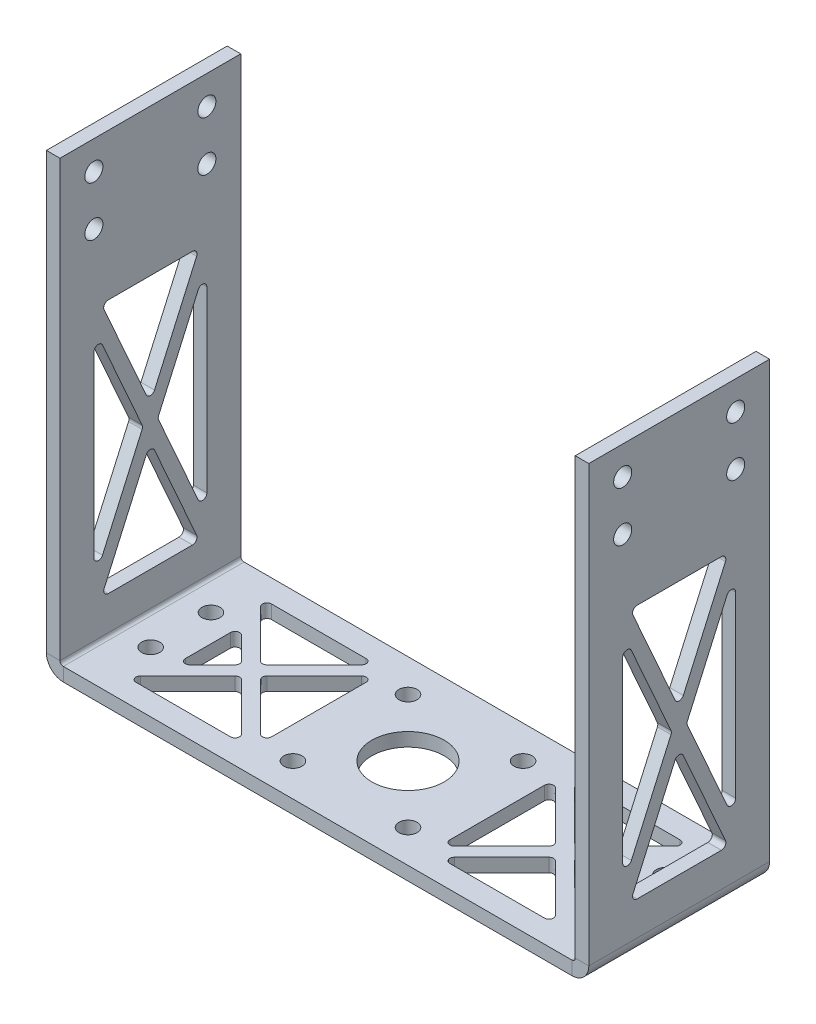
from build123d import *

# Parameters (mm, degrees)
SKETCH3_W                    = 114
SKETCH3_H                    = 40
BASE_FLANGE1_DEPTH           = 3
EDGE_FLANGE1_STRIP_W         = 13.4732
EDGE_FLANGE1_STRIP_H         = 3
EDGE_FLANGE1_STRIP_CUT_DEPTH = 40
EDGE_FLANGE1_DEPTH           = 40
EDGE_FLANGE2_STRIP_W         = 13.4732
EDGE_FLANGE2_STRIP_H         = 3
EDGE_FLANGE2_STRIP_CUT_DEPTH = 40
EDGE_FLANGE2_DEPTH           = 40
SKETCH11_R                   = 8
SKETCH11_R_2                 = 2
CUT_EXTRUDE1_DEPTH           = 10
CUT_EXTRUDE2_REACH           = 157.592
SKETCH12_R                   = 2
CUT_EXTRUDE3_DEPTH           = 156.592416268
CUT_EXTRUDE3_DEPTH_BACK      = 156.592416268
CUT_EXTRUDE4_DEPTH           = 10
FILLET1_R                    = 1


# Sheet-metal steps are written as plain solids
with BuildPart() as part:
    # Sketch3 → Base-Flange1 (new body)
    with BuildSketch(Plane(origin=(0, 0, 0), x_dir=(1, 0, 0), z_dir=(0, 1, 0))):
        Rectangle(SKETCH3_W, SKETCH3_H)
    extrude(amount=-BASE_FLANGE1_DEPTH)

    # Edge-Flange1 strip (across the edge) → Edge-Flange1 strip cut (cut)
    with BuildSketch(Plane(origin=(-57, 0, -20), x_dir=(1, 0, 0), z_dir=(0, 0, 1))):
        with Locations((-6, -1.5)):
            Rectangle(EDGE_FLANGE1_STRIP_W, EDGE_FLANGE1_STRIP_H)
    extrude(amount=EDGE_FLANGE1_STRIP_CUT_DEPTH, mode=Mode.SUBTRACT)

    # Edge-Flange1 section (across the edge) → Edge-Flange1 (add)
    with BuildSketch(Plane(origin=(-57, 0, -20), x_dir=(1, 0, 0), z_dir=(0, 0, 1))):
        with BuildLine():
            Line((-3, 0.7366), (-3, 97))
            Line((-3, 97), (0, 97))
            Line((0, 97), (0, 0.7366))
            ThreePointArc((0, 0.7366), (0.215745145, 0.215745145), (0.7366, 0))
            Line((0.7366, 0), (0.7366, -3))
            ThreePointArc((0.7366, -3), (-1.905575199, -1.905575199), (-3, 0.7366))
        make_face()
    extrude(amount=EDGE_FLANGE1_DEPTH)

    # Edge-Flange2 strip (across the edge) → Edge-Flange2 strip cut (cut)
    with BuildSketch(Plane(origin=(57, 0, 20), x_dir=(-1, 0, 0), z_dir=(0, 0, -1))):
        with Locations((-6, -1.5)):
            Rectangle(EDGE_FLANGE2_STRIP_W, EDGE_FLANGE2_STRIP_H)
    extrude(amount=EDGE_FLANGE2_STRIP_CUT_DEPTH, mode=Mode.SUBTRACT)

    # Edge-Flange2 section (across the edge) → Edge-Flange2 (add)
    with BuildSketch(Plane(origin=(57, 0, 20), x_dir=(-1, 0, 0), z_dir=(0, 0, -1))):
        with BuildLine():
            Line((-3, 0.7366), (-3, 97))
            Line((-3, 97), (0, 97))
            Line((0, 97), (0, 0.7366))
            ThreePointArc((0, 0.7366), (0.215745145, 0.215745145), (0.7366, 0))
            Line((0.7366, 0), (0.7366, -3))
            ThreePointArc((0.7366, -3), (-1.905575199, -1.905575199), (-3, 0.7366))
        make_face()
    extrude(amount=EDGE_FLANGE2_DEPTH)

    # Sketch11 → Cut-Extrude1 (cut)
    with BuildSketch(Plane(origin=(0, -3, 0), x_dir=(-1, 0, 0), z_dir=(0, -1, 0))):
        with Locations(Location((0, 0, 0), (0, 0, 90))):
            Circle(SKETCH11_R)
        with Locations(Location((12.727922061, 12.727922061, 0), (0, 0, 90))):
            Circle(SKETCH11_R_2)
        with Locations(Location((12.727922061, -12.727922061, 0), (0, 0, 90))):
            Circle(SKETCH11_R_2)
        with Locations(Location((-12.727922061, -12.727922061, 0), (0, 0, 90))):
            Circle(SKETCH11_R_2)
        with Locations(Location((-12.727922061, 12.727922061, 0), (0, 0, 90))):
            Circle(SKETCH11_R_2)
        with Locations(Location((50.2634, 6.666666667, 0), (0, 0, 90))):
            Circle(SKETCH11_R_2)
        with Locations(Location((-50.2634, 6.666666667, 0), (0, 0, 90))):
            Circle(SKETCH11_R_2)
        with Locations(Location((50.2634, -6.666666667, 0), (0, 0, 90))):
            Circle(SKETCH11_R_2)
        with Locations(Location((-50.2634, -6.666666667, 0), (0, 0, 90))):
            Circle(SKETCH11_R_2)
    extrude(amount=-CUT_EXTRUDE1_DEPTH, mode=Mode.SUBTRACT)

    # Cut-Extrude2: up to this face of the body (flat: up to its plane)
    cut_extrude2_end = Plane(part.part.faces().sort_by_distance((-60, 48.8683, 0))[0])
    # Sketch12 → Cut-Extrude2 (cut, up to the picked face)
    with BuildSketch(Plane(origin=(60, 0, 0), x_dir=(0, 0, -1), z_dir=(1, 0, 0)), mode=Mode.PRIVATE) as cut_extrude2_sk1:
        with Locations(Location((12.5, 79.674243403, 0), (0, 0, 90))):
            Circle(SKETCH12_R)
    cut_extrude2_tool1 = split(extrude(cut_extrude2_sk1.sketch, amount=-CUT_EXTRUDE2_REACH, mode=Mode.PRIVATE), bisect_by=cut_extrude2_end, keep=Keep.BOTH, mode=Mode.PRIVATE)
    # Sketch12 → Cut-Extrude2 (cut, up to the picked face)
    with BuildSketch(Plane(origin=(60, 0, 0), x_dir=(0, 0, -1), z_dir=(1, 0, 0)), mode=Mode.PRIVATE) as cut_extrude2_sk2:
        with Locations(Location((12.5, 90.674243403, 0), (0, 0, 90))):
            Circle(SKETCH12_R)
    cut_extrude2_tool2 = split(extrude(cut_extrude2_sk2.sketch, amount=-CUT_EXTRUDE2_REACH, mode=Mode.PRIVATE), bisect_by=cut_extrude2_end, keep=Keep.BOTH, mode=Mode.PRIVATE)
    # Sketch12 → Cut-Extrude2 (cut, up to the picked face)
    with BuildSketch(Plane(origin=(60, 0, 0), x_dir=(0, 0, -1), z_dir=(1, 0, 0)), mode=Mode.PRIVATE) as cut_extrude2_sk3:
        with Locations(Location((-12.5, 79.674243403, 0), (0, 0, 90))):
            Circle(SKETCH12_R)
    cut_extrude2_tool3 = split(extrude(cut_extrude2_sk3.sketch, amount=-CUT_EXTRUDE2_REACH, mode=Mode.PRIVATE), bisect_by=cut_extrude2_end, keep=Keep.BOTH, mode=Mode.PRIVATE)
    # Sketch12 → Cut-Extrude2 (cut, up to the picked face)
    with BuildSketch(Plane(origin=(60, 0, 0), x_dir=(0, 0, -1), z_dir=(1, 0, 0)), mode=Mode.PRIVATE) as cut_extrude2_sk4:
        with Locations(Location((-12.5, 90.674243403, 0), (0, 0, 90))):
            Circle(SKETCH12_R)
    cut_extrude2_tool4 = split(extrude(cut_extrude2_sk4.sketch, amount=-CUT_EXTRUDE2_REACH, mode=Mode.PRIVATE), bisect_by=cut_extrude2_end, keep=Keep.BOTH, mode=Mode.PRIVATE)
    add(cut_extrude2_tool1.solids().sort_by(Axis((60, 79.674243, -12.5), (-1, 0, 0)))[0], mode=Mode.SUBTRACT)
    add(cut_extrude2_tool2.solids().sort_by(Axis((60, 90.674243, -12.5), (-1, 0, 0)))[0], mode=Mode.SUBTRACT)
    add(cut_extrude2_tool3.solids().sort_by(Axis((60, 79.674243, 12.5), (-1, 0, 0)))[0], mode=Mode.SUBTRACT)
    add(cut_extrude2_tool4.solids().sort_by(Axis((60, 90.674243, 12.5), (-1, 0, 0)))[0], mode=Mode.SUBTRACT)

    # Sketch14 → Cut-Extrude3 (cut, two sides: drawn at the far end of the back side and taken through both)
    with BuildSketch(Plane(origin=(60, 0, 0), x_dir=(0, 0, -1), z_dir=(1, 0, 0)).offset(-CUT_EXTRUDE3_DEPTH_BACK)):
        Polygon((-12.5, 60.805943605), (-1.641411821, 36.3683), (-12.5, 11.930656395), align=None)
        Polygon((-10.858588179, 64.5), (0, 40.062356395), (10.858588179, 64.5), align=None)
        Polygon((12.5, 60.805943605), (1.641411821, 36.3683), (12.5, 11.930656395), align=None)
        Polygon((10.858588179, 8.2366), (0, 32.674243605), (-10.858588179, 8.2366), align=None)
    extrude(amount=CUT_EXTRUDE3_DEPTH + CUT_EXTRUDE3_DEPTH_BACK, mode=Mode.SUBTRACT)

    # Sketch15 → Cut-Extrude4 (cut)
    with BuildSketch(Plane.XZ.offset(3)):
        Polygon((19.727922061, 12.878679656), (32.606601718, 0), (19.727922061, -12.878679656), align=None)
        Polygon((21.849242405, 15), (34.727922061, 2.121320344), (47.606601718, 15), align=None)
        Polygon((44.2634, 7.414157595), (36.849242405, 0), (44.2634, -7.414157595), align=None)
        Polygon((47.606601718, -15), (34.727922061, -2.121320344), (21.849242405, -15), align=None)
        Polygon((-21.849242405, -15), (-47.606601718, -15), (-34.727922061, -2.121320344), align=None)
        Polygon((-44.2634, -7.414157595), (-44.2634, 7.414157595), (-36.849242405, 0), align=None)
        Polygon((-47.606601718, 15), (-21.849242405, 15), (-34.727922061, 2.121320344), align=None)
        Polygon((-19.727922061, -12.878679656), (-19.727922061, 12.878679656), (-32.606601718, 0), align=None)
    extrude(amount=-CUT_EXTRUDE4_DEPTH, mode=Mode.SUBTRACT)

    # Fillet1
    fillet1_edges = [part.edges().sort_by_distance(p)[0] for p in [
        (58.5, 60.805943605, -12.5),
        (-58.5, 60.805943605, -12.5),
        (58.5, 11.930656395, -12.5),
        (-58.5, 11.930656395, -12.5),
        (58.5, 36.3683, -1.641411821),
        (-58.5, 36.3683, -1.641411821),
        (58.5, 64.5, 10.858588179),
        (-58.5, 64.5, 10.858588179),
        (58.5, 64.5, -10.858588179),
        (-58.5, 64.5, -10.858588179),
        (58.5, 40.062356395, 0),
        (-58.5, 40.062356395, 0),
        (58.5, 8.2366, -10.858588179),
        (-58.5, 8.2366, -10.858588179),
        (58.5, 8.2366, 10.858588179),
        (-58.5, 8.2366, 10.858588179),
        (58.5, 32.674243605, 0),
        (-58.5, 32.674243605, 0),
        (58.5, 11.930656395, 12.5),
        (-58.5, 11.930656395, 12.5),
        (58.5, 60.805943605, 12.5),
        (-58.5, 60.805943605, 12.5),
        (58.5, 36.3683, 1.641411821),
        (-58.5, 36.3683, 1.641411821),
        (-34.727922061, -1.5, -2.121320344),
        (-21.849242405, -1.5, -15),
        (-47.606601718, -1.5, -15),
        (47.606601718, -1.5, -15),
        (21.849242405, -1.5, -15),
        (34.727922061, -1.5, -2.121320344),
        (21.849242405, -1.5, 15),
        (47.606601718, -1.5, 15),
        (34.727922061, -1.5, 2.121320344),
        (44.2634, -1.5, 7.414157595),
        (44.2634, -1.5, -7.414157595),
        (36.849242405, -1.5, 0),
        (-19.727922061, -1.5, -12.878679656),
        (-32.606601718, -1.5, 0),
        (-19.727922061, -1.5, 12.878679656),
        (-36.849242405, -1.5, 0),
        (-44.2634, -1.5, -7.414157595),
        (-44.2634, -1.5, 7.414157595),
        (-34.727922061, -1.5, 2.121320344),
        (-47.606601718, -1.5, 15),
        (-21.849242405, -1.5, 15),
        (19.727922061, -1.5, -12.878679656),
        (19.727922061, -1.5, 12.878679656),
        (32.606601718, -1.5, 0),
    ]]
    fillet(fillet1_edges, radius=FILLET1_R)


solid = part.part
